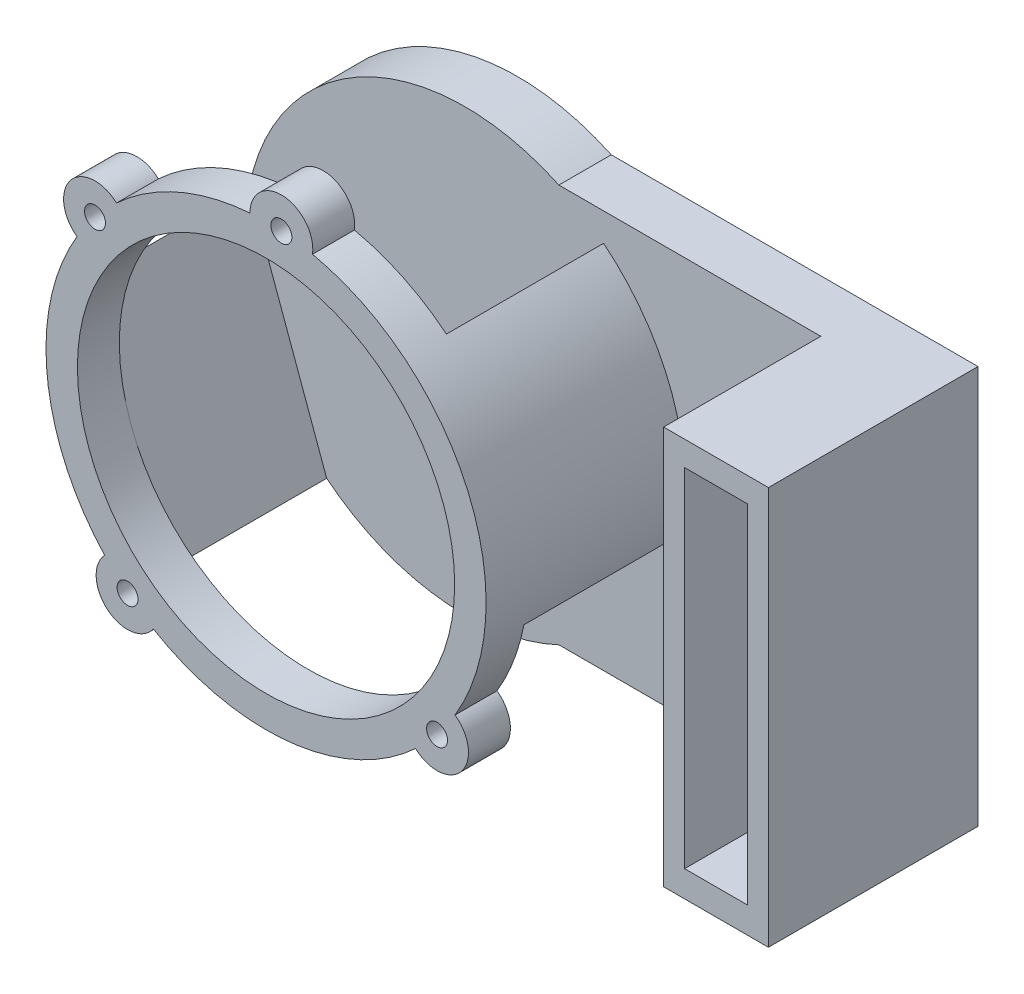
from build123d import *

# Parameters (mm, degrees)
ESTRUSIONE_ESTRUSIONE1_DEPTH = 2.5
SCHIZZO2_W                   = 10
SCHIZZO2_H                   = 38
ESTRUSIONE_ESTRUSIONE2_DEPTH = 15
SCHIZZO3_W                   = 6
SCHIZZO3_H                   = 33.15
TAGLIO_ESTRUSIONE1_DEPTH     = 13
ESTRUSIONE_SOTTILE1_START    = 19
SCHIZZO5_R                   = 21
SCHIZZO5_R_2                 = 18
ESTRUSIONE_SOTTILE1_DEPTH    = 19
SCHIZZO8_W                   = 36
SCHIZZO8_H                   = 15
TAGLIO_ESTRUSIONE2_DEPTH     = 70.157520353
SCHIZZO10_R                  = 3
ESTRUSIONE_ESTRUSIONE3_DEPTH = 4
FORO_PER_VITE_M1_6_1_D       = 2
FORO_PER_VITE_M1_6_1_DEPTH   = 3
FORO_PER_VITE_M1_6_1_TIP     = 0.600860619
SCHIZZO12_R                  = 1
TAGLIO_ESTRUSIONE3_DEPTH     = 3


with BuildPart() as part:
    # Schizzo1 → Estrusione-Estrusione1 (new, symmetric)
    with BuildSketch(Plane.XY):
        with BuildLine():
            Line((12.36549987, -26.390648792), (47.36549987, -26.390648792))
            Line((47.36549987, -26.390648792), (47.36549987, 11.609351208))
            Line((47.36549987, 11.609351208), (12.36549987, 11.609351208))
            ThreePointArc((12.36549987, 11.609351208), (-17.57877204, -7.390648792), (12.36549987, -26.390648792))
        make_face()
    extrude(amount=ESTRUSIONE_ESTRUSIONE1_DEPTH, both=True)

    # Schizzo2 → Estrusione-Estrusione2 (add)
    with BuildSketch(Plane.XY.offset(2.5)):
        with Locations((42.36549987, -7.390648792)):
            Rectangle(SCHIZZO2_W, SCHIZZO2_H)
    extrude(amount=ESTRUSIONE_ESTRUSIONE2_DEPTH)

    # Schizzo3 → Taglio-Estrusione1 (cut)
    with BuildSketch(Plane.XY.offset(17.5)):
        with Locations((42.36549987, -7.315648792)):
            Rectangle(SCHIZZO3_W, SCHIZZO3_H)
    extrude(amount=-TAGLIO_ESTRUSIONE1_DEPTH, mode=Mode.SUBTRACT)

    # Schizzo5 → Estrusione-Sottile1 (add)
    with BuildSketch(Plane.XY.offset(2.5).offset(ESTRUSIONE_SOTTILE1_START)):
        with Locations((3.42122796, -7.390648792)):
            Circle(SCHIZZO5_R)
        with Locations((3.42122796, -7.390648792)):
            Circle(SCHIZZO5_R_2, mode=Mode.SUBTRACT)
    extrude(amount=-ESTRUSIONE_SOTTILE1_DEPTH)

    # Schizzo8 → Taglio-Estrusione2 (cut, through all)
    with BuildSketch(Plane(origin=(-4.406906628, 12.10787645, 0), x_dir=(0.9396926207859102, 0.3420201433256638, 0), z_dir=(-0.3420201433256638, 0.9396926207859102, 0))):
        with Locations((0.687151909, -10)):
            Rectangle(SCHIZZO8_W, SCHIZZO8_H)
    extrude(amount=-TAGLIO_ESTRUSIONE2_DEPTH, mode=Mode.SUBTRACT)

    # Schizzo10 → Estrusione-Estrusione3 (add)
    with BuildSketch(Plane.XY.offset(21.5)):
        with Locations((-12.899464402, 5.82430489)):
            Circle(SCHIZZO10_R)
        with Locations((19.741920322, -20.605602474)):
            Circle(SCHIZZO10_R)
        with Locations((-9.793725722, -23.711341154)):
            Circle(SCHIZZO10_R)
        with Locations((4.88511972, 13.55826576)):
            Circle(SCHIZZO10_R)
    extrude(amount=-ESTRUSIONE_ESTRUSIONE3_DEPTH)

    # Foro per Vite M1.6-1
    with Locations(Plane(origin=(4.88511972, 13.55826576, 21.5), x_dir=(1, 0, 0), z_dir=(0, 0, 1))):
        with Locations((0, 0), (-17.784584122, -7.73396087), (-14.678845442, -37.269606914), (14.856800602, -34.163868234)):
            Hole(FORO_PER_VITE_M1_6_1_D / 2, depth=FORO_PER_VITE_M1_6_1_DEPTH)
            with Locations((0, 0, -(FORO_PER_VITE_M1_6_1_DEPTH + FORO_PER_VITE_M1_6_1_TIP / 2))):  # 118° drill point
                Cone(0, FORO_PER_VITE_M1_6_1_D / 2, FORO_PER_VITE_M1_6_1_TIP, mode=Mode.SUBTRACT)

    # Schizzo12 → Taglio-Estrusione3 (cut)
    with BuildSketch(Plane.XY.offset(2.5)):
        with Locations((3.42122796, -7.390648792)):
            Circle(SCHIZZO12_R)
    extrude(amount=-TAGLIO_ESTRUSIONE3_DEPTH, mode=Mode.SUBTRACT)


solid = part.part
